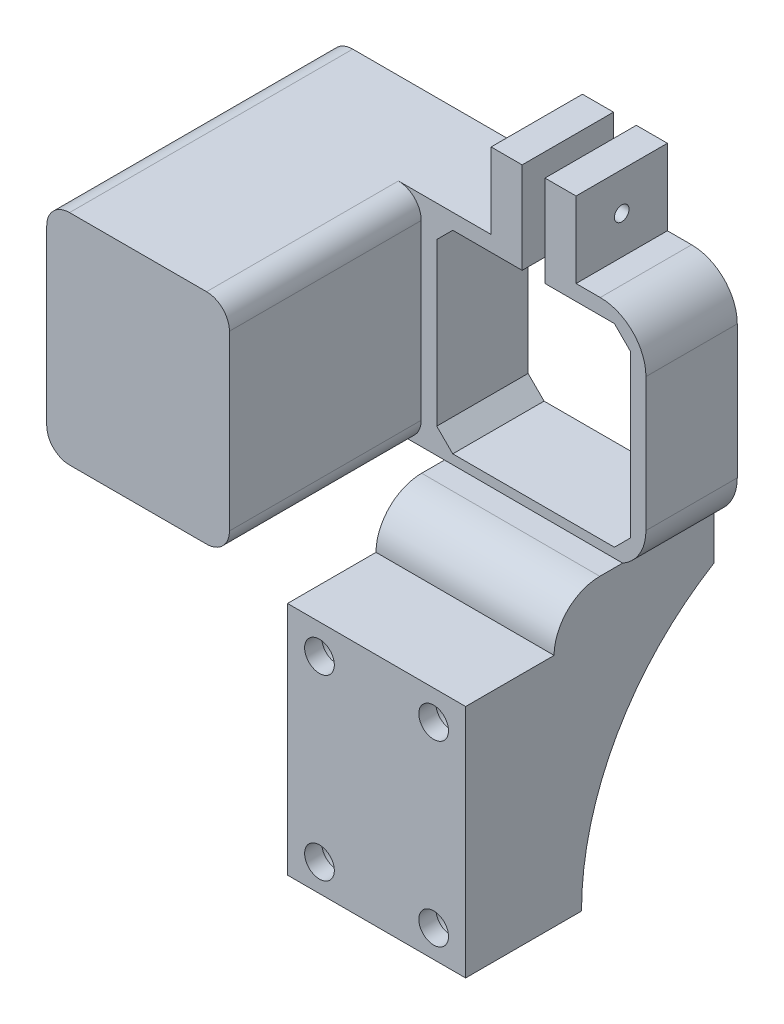
from build123d import *

# Parameters (mm, degrees)
SKETCH1_W           = 49.2
SKETCH1_H           = 49.2
SKETCH1_W_2         = 42.4
SKETCH1_H_2         = 42.4
BOSS_EXTRUDE1_DEPTH = 10
CHAMFER1_SIZE       = 3.5
FILLET1_R           = 10
CUT_EXTRUDE1_REACH  = 42.129
SKETCH2_W           = 18.6
SKETCH2_H           = 6.8
SKETCH4_W           = 6.8
SKETCH4_H           = 20
BOSS_EXTRUDE2_DEPTH = 20
SKETCH5_R           = 1.6
CUT_EXTRUDE2_DEPTH  = 55.283054446
BOSS_EXTRUDE3_DEPTH = 25
SKETCH8_W           = 39
SKETCH8_H           = 10
BOSS_EXTRUDE4_DEPTH = 10
FILLET3_R           = 10
CUT_EXTRUDE3_REACH  = 100.797
SKETCH10_W          = 19
SKETCH10_H          = 51.482775671
FILLET4_R           = 60
SKETCH11_R          = 3.25
CUT_EXTRUDE4_DEPTH  = 95.979997894
SKETCH15_R          = 4.5
CUT_EXTRUDE6_DEPTH  = 31.25
SKETCH16_R          = 4.5
CUT_EXTRUDE7_DEPTH  = 31.25
BOSS_EXTRUDE5_START = 19.38
SKETCH17_R          = 3.25
BOSS_EXTRUDE5_DEPTH = 19.38
SKETCH18_R          = 4.5
CUT_EXTRUDE8_DEPTH  = 19.38
BOSS_EXTRUDE6_DEPTH = 20
FILLET6_R           = 5
BOSS_EXTRUDE7_DEPTH = 42
FILLET7_R           = 5


with BuildPart() as part:
    # Sketch1 → Boss-Extrude1 (new, symmetric)
    with BuildSketch(Plane.XY):
        Rectangle(SKETCH1_W, SKETCH1_H)
        Rectangle(SKETCH1_W_2, SKETCH1_H_2, mode=Mode.SUBTRACT)
    extrude(amount=BOSS_EXTRUDE1_DEPTH, both=True)

    # Chamfer1
    chamfer1_edges = [part.edges().sort_by_distance(p)[0] for p in [
        (21.2, -21.2, 0),
        (21.2, 21.2, 0),
        (-21.2, 21.2, 0),
        (-21.2, -21.2, 0),
    ]]
    chamfer(chamfer1_edges, length=CHAMFER1_SIZE)

    # Fillet1
    fillet1_edges = [part.edges().sort_by_distance(p)[0] for p in [
        (24.6, -24.6, 0),
        (-24.6, -24.6, 0),
        (-24.6, 24.6, 0),
        (24.6, 24.6, 0),
    ]]
    fillet(fillet1_edges, radius=FILLET1_R)

    # Sketch2 → Cut-Extrude1 (cut, up to next)
    with BuildSketch(Plane.XY.offset(10), mode=Mode.PRIVATE) as cut_extrude1_sk1:
        with Locations((0, 21.2)):
            Rectangle(SKETCH2_W, SKETCH2_H)
    cut_extrude1_tool1 = extrude(cut_extrude1_sk1.sketch, amount=-CUT_EXTRUDE1_REACH, mode=Mode.PRIVATE) & part.part
    add(cut_extrude1_tool1.solids().sort_by_distance((0, 21.2, 10))[0], mode=Mode.SUBTRACT)

    # Sketch4 → Boss-Extrude2 (add)
    with BuildSketch(Plane.XZ.offset(-21.2)):
        with Locations((-5.9, 0)):
            Rectangle(SKETCH4_W, SKETCH4_H)
        with Locations((5.9, 0)):
            Rectangle(SKETCH4_W, SKETCH4_H)
    extrude(amount=-BOSS_EXTRUDE2_DEPTH)

    # Sketch5 → Cut-Extrude2 (cut, through all)
    with BuildSketch(Plane(origin=(9.3, 0, 0), x_dir=(0, 0, -1), z_dir=(1, 0, 0))):
        with Locations((0, 32.9)):
            Circle(SKETCH5_R)
    extrude(amount=-CUT_EXTRUDE2_DEPTH, mode=Mode.SUBTRACT)

    # Sketch7 → Boss-Extrude3 (add)
    with BuildSketch(Plane.XY):
        Polygon((-19.5, -24.6), (-19.5, -84.8), (19.5, -84.8), (19.5, -24.6), (19.5, -23.273751878), (-19.5, -23.317224329), align=None)
    extrude(amount=BOSS_EXTRUDE3_DEPTH)

    # Sketch8 → Boss-Extrude4 (add)
    with BuildSketch(Plane(origin=(0, 0, 0), x_dir=(-1, 0, 0), z_dir=(0, 0, -1))):
        with Locations((0, -28.317224329)):
            Rectangle(SKETCH8_W, SKETCH8_H)
    extrude(amount=BOSS_EXTRUDE4_DEPTH)

    # Fillet3
    fillet3_edges = [part.edges().sort_by_distance(p)[0] for p in [
        (0, -23.295488103, 25),
    ]]
    fillet(fillet3_edges, radius=FILLET3_R)

    # Sketch10 → Cut-Extrude3 (cut, up to next)
    with BuildSketch(Plane.ZY.offset(19.5), mode=Mode.PRIVATE) as cut_extrude3_sk1:
        with Locations((9.5, -59.058612165)):
            Rectangle(SKETCH10_W, SKETCH10_H)
    cut_extrude3_tool1 = extrude(cut_extrude3_sk1.sketch, amount=-CUT_EXTRUDE3_REACH, mode=Mode.PRIVATE) & part.part
    add(cut_extrude3_tool1.solids().sort_by_distance((-19.5, -59.058612, 9.5))[0], mode=Mode.SUBTRACT)

    # Fillet4
    # the kernel refuses this fillet: 60 mm, written as the material it adds along each edge
    with BuildSketch(Plane(origin=(-19.5, -33.317224329, 19), x_dir=(0, -1, 0), z_dir=(1, 0, 0))) as fillet4_piece_1:
        with BuildLine():
            CenterArc((51.371198156, 60), FILLET4_R, 211.108922511, 58.891077489)
            Line((0, 29), (0, 0))
            Line((0, 0), (51.371198156, 0))
        make_face()
    extrude(amount=39)

    # Sketch11 → Cut-Extrude4 (cut, through all)
    with BuildSketch(Plane.XY.offset(25)):
        with Locations((-12.5, -39.8)):
            Circle(SKETCH11_R)
        with Locations((12.5, -39.8)):
            Circle(SKETCH11_R)
        with Locations((-12.5, -78.8)):
            Circle(SKETCH11_R)
        with Locations((12.5, -78.8)):
            Circle(SKETCH11_R)
    extrude(amount=-CUT_EXTRUDE4_DEPTH, mode=Mode.SUBTRACT)

    # Sketch15 → Cut-Extrude6 (cut)
    with BuildSketch(Plane(origin=(0, 0, -10), x_dir=(-1, 0, 0), z_dir=(0, 0, -1))):
        with Locations((-12.5, -39.8)):
            Circle(SKETCH15_R)
        with Locations((12.5, -39.8)):
            Circle(SKETCH15_R)
    extrude(amount=-CUT_EXTRUDE6_DEPTH, mode=Mode.SUBTRACT)

    # Sketch16 → Cut-Extrude7 (cut)
    with BuildSketch(Plane(origin=(0, 0, -10), x_dir=(-1, 0, 0), z_dir=(0, 0, -1))):
        with Locations((-12.5, -78.8)):
            Circle(SKETCH16_R)
        with Locations((12.5, -78.8)):
            Circle(SKETCH16_R)
    extrude(amount=-CUT_EXTRUDE7_DEPTH, mode=Mode.SUBTRACT)

    # Sketch17 → Boss-Extrude5 (add)
    with BuildSketch(Plane.XY.offset(25).offset(BOSS_EXTRUDE5_START)):
        Polygon((19.5, -84.8), (19.5, -33.27375809), (-19.5, -33.317230541), (-19.5, -84.8), align=None)
        with Locations((-12.5, -78.8)):
            Circle(SKETCH17_R, mode=Mode.SUBTRACT)
        with Locations((12.5, -78.8)):
            Circle(SKETCH17_R, mode=Mode.SUBTRACT)
        with Locations((12.5, -39.8)):
            Circle(SKETCH17_R, mode=Mode.SUBTRACT)
        with Locations((-12.5, -39.8)):
            Circle(SKETCH17_R, mode=Mode.SUBTRACT)
    extrude(amount=-BOSS_EXTRUDE5_DEPTH)

    # Sketch18 → Cut-Extrude8 (cut)
    with BuildSketch(Plane(origin=(0, 0, 21.25), x_dir=(-1, 0, 0), z_dir=(0, 0, -1))):
        with Locations((12.5, -78.8)):
            Circle(SKETCH18_R)
        with Locations((-12.5, -78.8)):
            Circle(SKETCH18_R)
        with Locations((12.5, -39.8)):
            Circle(SKETCH18_R)
        with Locations((-12.5, -39.8)):
            Circle(SKETCH18_R)
    extrude(amount=-CUT_EXTRUDE8_DEPTH, mode=Mode.SUBTRACT)

    # Sketch20 → Boss-Extrude6 (add)
    with BuildSketch(Plane.XY.offset(10)):
        with BuildLine():
            Line((64.6, 24.6), (14.6, 24.6))
            ThreePointArc((14.6, 24.6), (21.671067812, 21.671067812), (24.6, 14.6))
            Line((24.6, 14.6), (24.6, -14.6))
            ThreePointArc((24.6, -14.6), (23.253481333, -19.611712364), (19.576547836, -23.273751878))
            Line((19.576547836, -23.273751878), (64.6, -23.273751878))
            Line((64.6, -23.273751878), (64.6, 24.6))
        make_face()
    extrude(amount=-BOSS_EXTRUDE6_DEPTH)

    # Fillet6
    fillet6_edges = [part.edges().sort_by_distance(p)[0] for p in [
        (64.6, -23.273751878, 0),
        (64.6, 24.6, 0),
    ]]
    fillet(fillet6_edges, radius=FILLET6_R)

    # Sketch21 → Boss-Extrude7 (add)
    with BuildSketch(Plane.XY.offset(10)):
        with BuildLine():
            Line((24.6, 24.6), (24.6, -23.273751878))
            Line((24.6, -23.273751878), (59.6, -23.273751878))
            ThreePointArc((59.6, -23.273751878), (63.135533906, -21.809285784), (64.6, -18.273751878))
            Line((64.6, -18.273751878), (64.6, 19.6))
            ThreePointArc((64.6, 19.6), (63.135533906, 23.135533906), (59.6, 24.6))
            Line((59.6, 24.6), (24.6, 24.6))
        make_face()
    extrude(amount=BOSS_EXTRUDE7_DEPTH)

    # Fillet7
    fillet7_edges = [part.edges().sort_by_distance(p)[0] for p in [
        (24.6, 24.6, 31),
        (24.6, -23.273751878, 31),
    ]]
    fillet(fillet7_edges, radius=FILLET7_R)


with BuildPart() as body_2:
    # Mirror1: mirrored copy
    add(part.part.mirror(Plane(origin=(-24.6, -24.6, 10), x_dir=(0, 0, 1), z_dir=(1, 0, 0))))


solid = body_2.part
